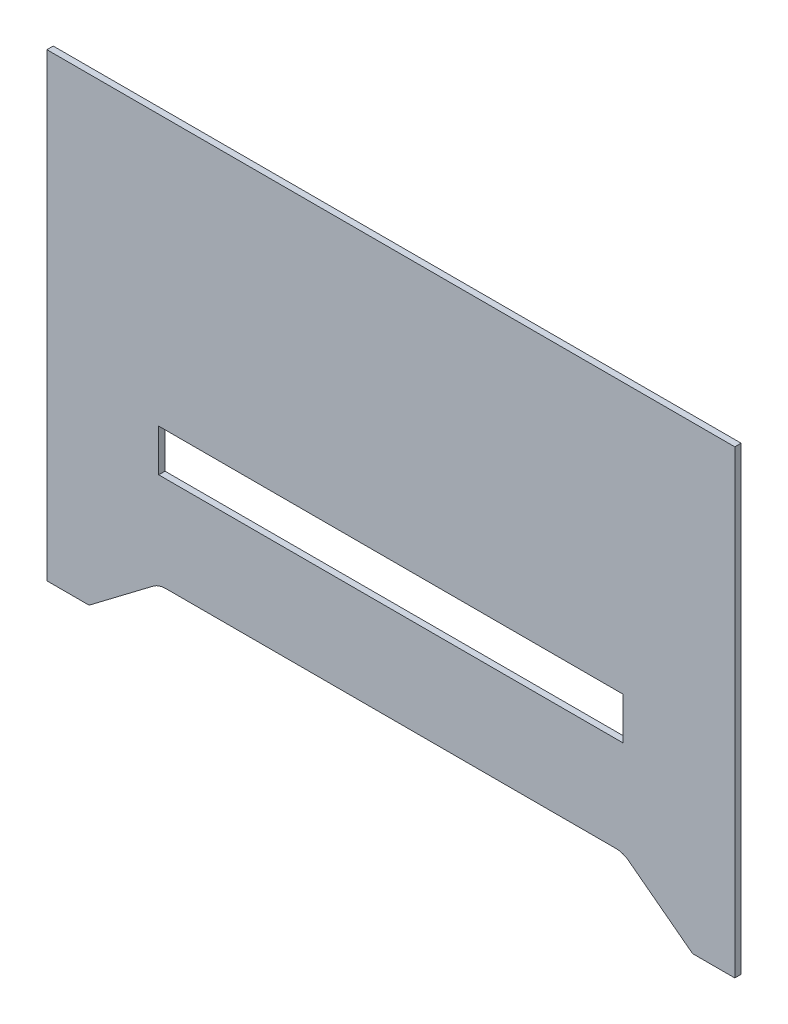
from build123d import *

# Parameters (mm, degrees)
SKETCH1_W           = 220
SKETCH1_H           = 20
BOSS_EXTRUDE1_DEPTH = 3


with BuildPart() as part:
    # Sketch1 → Boss-Extrude1 (new body)
    with BuildSketch(Plane.XY):
        with BuildLine():
            Line((-163, -109), (-163, 109))
            Line((-163, 109), (163, 109))
            Line((163, 109), (163, -109))
            Line((163, -109), (143, -109))
            Line((143, -109), (112.678383644, -86.029078518))
            ThreePointArc((112.678383644, -86.029078518), (109.824990055, -84.520832979), (106.639806764, -84))
            Line((106.639806764, -84), (-106.639806764, -84))
            ThreePointArc((-106.639806764, -84), (-109.824990055, -84.520832979), (-112.678383644, -86.029078518))
            Line((-112.678383644, -86.029078518), (-143, -109))
            Line((-143, -109), (-163, -109))
        make_face()
        with Locations((0, -29)):
            Rectangle(SKETCH1_W, SKETCH1_H, mode=Mode.SUBTRACT)
    extrude(amount=BOSS_EXTRUDE1_DEPTH)


solid = part.part
